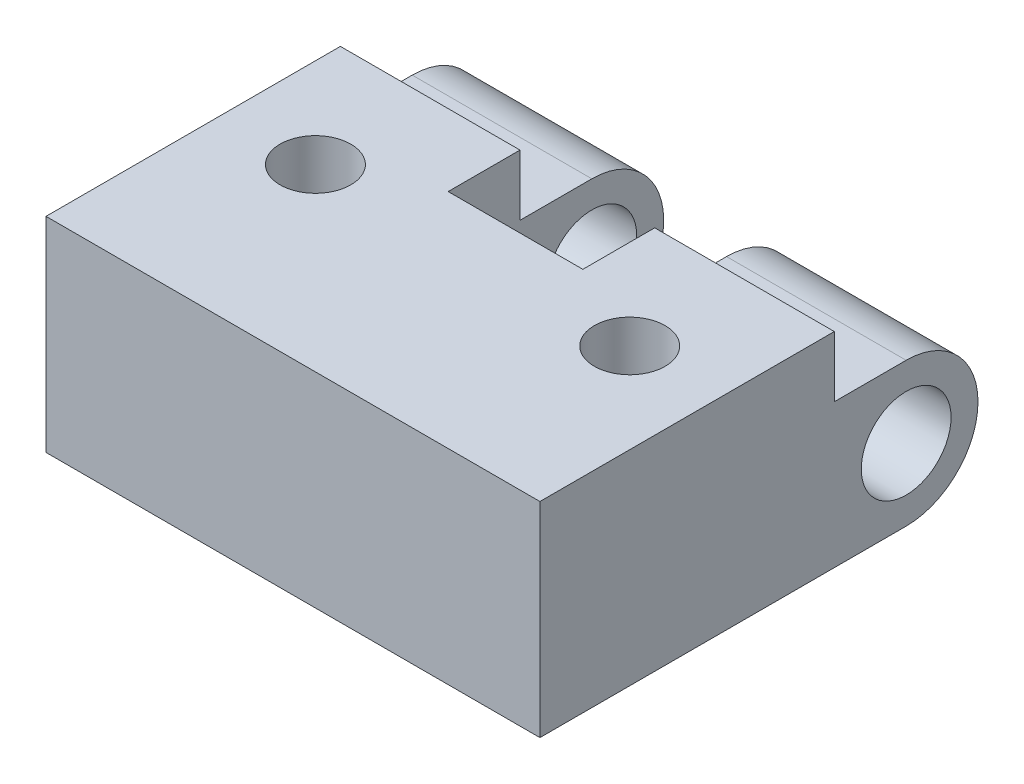
from build123d import *

# Parameters (mm, degrees)
SKETCH2_R           = 1.5875
BOSS_EXTRUDE1_DEPTH = 6.35
CUT_EXTRUDE1_DEPTH  = 10
BOSS_EXTRUDE2_DEPTH = 4.7625
BOSS_EXTRUDE3_DEPTH = 2.150000018
SKETCH7_R           = 1.25
CUT_EXTRUDE2_DEPTH  = 21.353004305


with BuildPart() as part:
    # Sketch2 → Boss-Extrude1 (new body)
    with BuildSketch(Plane(origin=(0, 0, 0), x_dir=(0, 0, -1), z_dir=(1, 0, 0))):
        with BuildLine():
            Line((6.597804878, 5.08), (-6.35, 5.08))
            Line((-6.35, 5.08), (-6.35, 0))
            Line((-6.35, 0), (6.597804878, 0))
            ThreePointArc((6.597804878, 0), (9.137804878, 2.54), (6.597804878, 5.08))
        make_face()
        with Locations((6.597804878, 2.54)):
            Circle(SKETCH2_R, mode=Mode.SUBTRACT)
    boss_extrude1 = extrude(amount=BOSS_EXTRUDE1_DEPTH)

    # Sketch3 → Cut-Extrude1 (cut)
    with BuildSketch(Plane(origin=(0, 5.08, 0), x_dir=(1, 0, 0), z_dir=(0, 1, 0))):
        with BuildLine():
            ThreePointArc((3.175, -1.5), (4.235660172, -1.060660172), (4.675, 0))
            ThreePointArc((4.675, 0), (2.114339828, 1.060660172), (3.175, -1.5))
        make_face()
    cut_extrude1 = extrude(amount=-CUT_EXTRUDE1_DEPTH, mode=Mode.SUBTRACT)

    # Sketch4 → Boss-Extrude2 (add)
    with BuildSketch(Plane(origin=(6.35, 0, 0), x_dir=(0, 0, -1), z_dir=(1, 0, 0))):
        Polygon((-6.35, 0), (1.517804878, 0), (1.517804878, 2.54), (1.517804878, 5.08), (-6.35, 5.08), align=None)
    extrude(amount=BOSS_EXTRUDE2_DEPTH)

    # Mirror1: Boss-Extrude1, Cut-Extrude1 across plane
    add(boss_extrude1.mirror(Plane(origin=(8.73125, 0, 0), x_dir=(0, 0, 1), z_dir=(1, 0, 0))))
    add(cut_extrude1.mirror(Plane(origin=(8.73125, 0, 0), x_dir=(0, 0, 1), z_dir=(1, 0, 0))), mode=Mode.SUBTRACT)

    # Sketch6 → Boss-Extrude3 (add)
    with BuildSketch(Plane(origin=(0, 5.08, 0), x_dir=(1, 0, 0), z_dir=(0, 1, 0))):
        Polygon((6.35, 4.057804878), (0, 4.057804878), (0, -6.35), (17.4625, -6.35), (17.4625, 4.057804878), (11.1125, 4.057804878), (11.1125, 1.517804878), (6.35, 1.517804878), align=None)
    extrude(amount=BOSS_EXTRUDE3_DEPTH)

    # Sketch7 → Cut-Extrude2 (cut, through all)
    with BuildSketch(Plane.XZ.offset(-5.08)):
        with Locations((14.2875, 0)):
            Circle(SKETCH7_R)
        with Locations((3.175, 0)):
            Circle(SKETCH7_R)
    extrude(amount=-CUT_EXTRUDE2_DEPTH, mode=Mode.SUBTRACT)


solid = part.part
